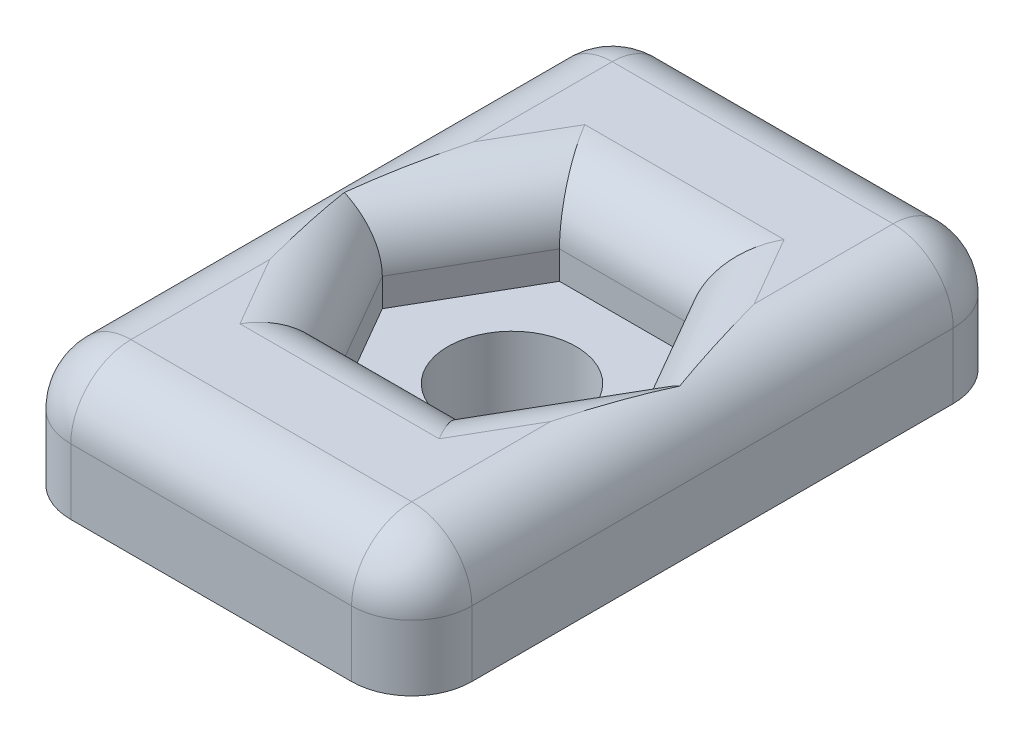
from build123d import *

# Parameters (mm, degrees)
SKETCH1_W            = 10
SKETCH1_H            = 15
BOSS_EXTRUDE1_DEPTH  = 4
CUT_EXTRUDE1_DEPTH   = 2.2
M3_CLEARANCE_HOLE1_D = 3.2
FILLET1_R            = 1.5
CHAMFER1_SIZE        = 0.866025404
CHAMFER1_SIZE_2      = 1.5


with BuildPart() as part:
    # Sketch1 → Boss-Extrude1 (new body)
    with BuildSketch(Plane(origin=(0, 0, 0), x_dir=(1, 0, 0), z_dir=(0, 1, 0))):
        with Locations((5, 7.5)):
            Rectangle(SKETCH1_W, SKETCH1_H)
    extrude(amount=BOSS_EXTRUDE1_DEPTH)

    # Sketch2 → Cut-Extrude1 (cut)
    with BuildSketch(Plane(origin=(0, 4, 0), x_dir=(1, 0, 0), z_dir=(0, 1, 0))):
        Polygon((8.233161507, 7.5), (6.616580754, 10.3), (3.383419246, 10.3), (1.766838493, 7.5), (3.383419246, 4.7), (6.616580754, 4.7), align=None)
    extrude(amount=-CUT_EXTRUDE1_DEPTH, mode=Mode.SUBTRACT)

    # M3 Clearance Hole1 (through all)
    with Locations(Plane(origin=(5, 1.8, -7.5), x_dir=(0, 0, 1), z_dir=(0, 1, 0))):
        with Locations((0, 0)):
            Hole(M3_CLEARANCE_HOLE1_D / 2)

    # Fillet1
    # the kernel refuses this fillet: 1.5 mm, written as the material it takes off along each edge
    with BuildSketch(Plane(origin=(8.5, 2.5, -1.5), x_dir=(1, 0, 0), z_dir=(0, 0, 1))) as fillet1_piece_1_section:
        Polygon((0, 0), (FILLET1_R, 0), (FILLET1_R, FILLET1_R), (0, FILLET1_R), align=None)
    fillet1_piece_1 = extrude(amount=FILLET1_R, mode=Mode.PRIVATE)
    fillet1_piece_1 = fillet1_piece_1 - Plane(origin=(8.5, 2.5, -1.5), x_dir=(-0.7071067811865475, -0.7071067811865475, 0), z_dir=(0, 0, 1)) * Sphere(FILLET1_R, mode=Mode.PRIVATE)
    add(fillet1_piece_1, mode=Mode.SUBTRACT)
    with BuildSketch(Plane(origin=(8.5, 2.5, -13.5), x_dir=(0, 1, 0), z_dir=(1, 0, 0))) as fillet1_piece_2_section:
        Polygon((0, 0), (FILLET1_R, 0), (FILLET1_R, -FILLET1_R), (0, -FILLET1_R), align=None)
    fillet1_piece_2 = extrude(amount=FILLET1_R, mode=Mode.PRIVATE)
    fillet1_piece_2 = fillet1_piece_2 - Plane(origin=(8.5, 2.5, -13.5), x_dir=(0, -0.7071067811865475, 0.7071067811865475), z_dir=(1, 0, 0)) * Sphere(FILLET1_R, mode=Mode.PRIVATE)
    add(fillet1_piece_2, mode=Mode.SUBTRACT)
    with BuildSketch(Plane(origin=(1.5, 2.5, -13.5), x_dir=(0, 1, 0), z_dir=(-1, 0, 0))) as fillet1_piece_3_section:
        Polygon((0, 0), (FILLET1_R, 0), (FILLET1_R, FILLET1_R), (0, FILLET1_R), align=None)
    fillet1_piece_3 = extrude(amount=FILLET1_R, mode=Mode.PRIVATE)
    fillet1_piece_3 = fillet1_piece_3 - Plane(origin=(1.5, 2.5, -13.5), x_dir=(0, -0.7071067811865475, 0.7071067811865475), z_dir=(-1, 0, 0)) * Sphere(FILLET1_R, mode=Mode.PRIVATE)
    add(fillet1_piece_3, mode=Mode.SUBTRACT)
    with BuildSketch(Plane(origin=(1.5, 2.5, -1.5), x_dir=(-1, 0, 0), z_dir=(0, 0, 1))) as fillet1_piece_4_section:
        Polygon((0, 0), (FILLET1_R, 0), (FILLET1_R, -FILLET1_R), (0, -FILLET1_R), align=None)
    fillet1_piece_4 = extrude(amount=FILLET1_R, mode=Mode.PRIVATE)
    fillet1_piece_4 = fillet1_piece_4 - Plane(origin=(1.5, 2.5, -1.5), x_dir=(0.7071067811865475, -0.7071067811865475, 0), z_dir=(0, 0, 1)) * Sphere(FILLET1_R, mode=Mode.PRIVATE)
    add(fillet1_piece_4, mode=Mode.SUBTRACT)
    with BuildSketch(Plane(origin=(10, 4, -1.5), x_dir=(0, -1, 0), z_dir=(0, 0, -1)), Plane(origin=(0, 4, -13.5), x_dir=(0, -1, 0), z_dir=(0, 0, 1))) as fillet1_piece_5:
        with BuildLine():
            CenterArc((FILLET1_R, FILLET1_R), FILLET1_R, 180, 90)
            Line((0, FILLET1_R), (0, 0))
            Line((0, 0), (FILLET1_R, 0))
        make_face()
    extrude(amount=12, mode=Mode.SUBTRACT)
    with BuildSketch(Plane(origin=(8.5, 4, -15), x_dir=(0, 0, 1), z_dir=(-1, 0, 0))) as fillet1_piece_6:
        with BuildLine():
            CenterArc((FILLET1_R, -FILLET1_R), FILLET1_R, 90, 90)
            Line((0, -FILLET1_R), (0, 0))
            Line((0, 0), (FILLET1_R, 0))
        make_face()
    extrude(amount=7, mode=Mode.SUBTRACT)
    with BuildSketch(Plane(origin=(4.741580754, 4, -1.452404736), x_dir=(0.866025403784439, 0, 0.49999999999999933), z_dir=(0.49999999999999933, 0, -0.866025403784439))) as fillet1_piece_7_section:
        with BuildLine():
            CenterArc((FILLET1_R, FILLET1_R), FILLET1_R, 180, 90)
            Line((0, FILLET1_R), (0, 0))
            Line((0, 0), (FILLET1_R, 0))
        make_face()
    fillet1_piece_7 = extrude(amount=10.733161507, mode=Mode.PRIVATE)
    fillet1_piece_7 = split(fillet1_piece_7, bisect_by=Plane(origin=(9.978951884, 4, -4.476202368), z_dir=(-0.8660254037844388, 0, 0.4999999999999998)), keep=Keep.TOP, mode=Mode.PRIVATE)
    fillet1_piece_7 = split(fillet1_piece_7, bisect_by=Plane(origin=(4.741580754, 4, -4.7), z_dir=(0, 0, -1)), keep=Keep.TOP, mode=Mode.PRIVATE)
    add(fillet1_piece_7, mode=Mode.SUBTRACT)
    with BuildSketch(Plane(origin=(10.108161507, 4, -4.252404736), x_dir=(0.8660254037844388, 0, -0.4999999999999998), z_dir=(-0.4999999999999998, 0, -0.8660254037844388))) as fillet1_piece_8_section:
        with BuildLine():
            CenterArc((FILLET1_R, FILLET1_R), FILLET1_R, 180, 90)
            Line((0, FILLET1_R), (0, 0))
            Line((0, 0), (FILLET1_R, 0))
        make_face()
    fillet1_piece_8 = extrude(amount=10.733161507, mode=Mode.PRIVATE)
    fillet1_piece_8 = split(fillet1_piece_8, bisect_by=Plane(origin=(7.295661507, 4, -5.876202368), z_dir=(-0.866025403784439, 0, -0.49999999999999933)), keep=Keep.TOP, mode=Mode.PRIVATE)
    fillet1_piece_8 = split(fillet1_piece_8, bisect_by=Plane(origin=(10.108161507, 4, -10.3), z_dir=(0, 0, 1)), keep=Keep.TOP, mode=Mode.PRIVATE)
    add(fillet1_piece_8, mode=Mode.SUBTRACT)
    with BuildSketch(Plane(origin=(10.366580754, 4, -10.3), x_dir=(0, 0, -1), z_dir=(-1, 0, 0))) as fillet1_piece_9_section:
        with BuildLine():
            CenterArc((FILLET1_R, FILLET1_R), FILLET1_R, 180, 90)
            Line((0, FILLET1_R), (0, 0))
            Line((0, 0), (FILLET1_R, 0))
        make_face()
    fillet1_piece_9 = extrude(amount=10.733161507, mode=Mode.PRIVATE)
    fillet1_piece_9 = split(fillet1_piece_9, bisect_by=Plane(origin=(7.554080754, 4, -8.676202368), z_dir=(-0.8660254037844388, 0, 0.4999999999999998)), keep=Keep.TOP, mode=Mode.PRIVATE)
    fillet1_piece_9 = split(fillet1_piece_9, bisect_by=Plane(origin=(5.129209623, 4, -13.323797632), z_dir=(0.8660254037844387, 0, 0.49999999999999994)), keep=Keep.TOP, mode=Mode.PRIVATE)
    add(fillet1_piece_9, mode=Mode.SUBTRACT)
    with BuildSketch(Plane(origin=(5.258419246, 4, -13.547595264), x_dir=(-0.8660254037844387, 0, -0.49999999999999994), z_dir=(-0.49999999999999994, 0, 0.8660254037844387))) as fillet1_piece_10_section:
        with BuildLine():
            CenterArc((FILLET1_R, FILLET1_R), FILLET1_R, 180, 90)
            Line((0, FILLET1_R), (0, 0))
            Line((0, 0), (FILLET1_R, 0))
        make_face()
    fillet1_piece_10 = extrude(amount=10.733161507, mode=Mode.PRIVATE)
    fillet1_piece_10 = split(fillet1_piece_10, bisect_by=Plane(origin=(5.258419246, 4, -10.3), z_dir=(0, 0, 1)), keep=Keep.TOP, mode=Mode.PRIVATE)
    fillet1_piece_10 = split(fillet1_piece_10, bisect_by=Plane(origin=(0.021048116, 4, -10.523797632), z_dir=(0.8660254037844386, 0, -0.5000000000000001)), keep=Keep.TOP, mode=Mode.PRIVATE)
    add(fillet1_piece_10, mode=Mode.SUBTRACT)
    with BuildSketch(Plane(origin=(-0.108161507, 4, -10.747595264), x_dir=(-0.8660254037844387, 0, 0.5000000000000001), z_dir=(0.5000000000000001, 0, 0.8660254037844386))) as fillet1_piece_11_section:
        with BuildLine():
            CenterArc((FILLET1_R, FILLET1_R), FILLET1_R, 180, 90)
            Line((0, FILLET1_R), (0, 0))
            Line((0, 0), (FILLET1_R, 0))
        make_face()
    fillet1_piece_11 = extrude(amount=10.733161507, mode=Mode.PRIVATE)
    fillet1_piece_11 = split(fillet1_piece_11, bisect_by=Plane(origin=(2.704338493, 4, -9.123797632), z_dir=(0.8660254037844387, 0, 0.49999999999999994)), keep=Keep.TOP, mode=Mode.PRIVATE)
    fillet1_piece_11 = split(fillet1_piece_11, bisect_by=Plane(origin=(-0.108161507, 4, -4.7), z_dir=(0, 0, -1)), keep=Keep.TOP, mode=Mode.PRIVATE)
    add(fillet1_piece_11, mode=Mode.SUBTRACT)
    with BuildSketch(Plane(origin=(-0.366580754, 4, -4.7), x_dir=(0, 0, 1), z_dir=(1, 0, 0))) as fillet1_piece_12_section:
        with BuildLine():
            CenterArc((FILLET1_R, FILLET1_R), FILLET1_R, 180, 90)
            Line((0, FILLET1_R), (0, 0))
            Line((0, 0), (FILLET1_R, 0))
        make_face()
    fillet1_piece_12 = extrude(amount=10.733161507, mode=Mode.PRIVATE)
    fillet1_piece_12 = split(fillet1_piece_12, bisect_by=Plane(origin=(2.445919246, 4, -6.323797632), z_dir=(0.8660254037844386, 0, -0.5000000000000001)), keep=Keep.TOP, mode=Mode.PRIVATE)
    fillet1_piece_12 = split(fillet1_piece_12, bisect_by=Plane(origin=(4.870790377, 4, -1.676202368), z_dir=(-0.866025403784439, 0, -0.49999999999999933)), keep=Keep.TOP, mode=Mode.PRIVATE)
    add(fillet1_piece_12, mode=Mode.SUBTRACT)
    with BuildSketch(Plane(origin=(0, -3.75, -15), x_dir=(0, 0, 1), z_dir=(0, 1, 0)), Plane(origin=(0, -3.75, 0), x_dir=(1, 0, 0), z_dir=(0, 1, 0))) as fillet1_piece_13:
        with BuildLine():
            CenterArc((FILLET1_R, FILLET1_R), FILLET1_R, 180, 90)
            Line((0, FILLET1_R), (0, 0))
            Line((0, 0), (FILLET1_R, 0))
        make_face()
    extrude(amount=6.25, mode=Mode.SUBTRACT)
    with BuildSketch(Plane(origin=(10, -3.75, -15), x_dir=(0, 0, 1), z_dir=(0, 1, 0)), Plane(origin=(10, -3.75, 0), x_dir=(-1, 0, 0), z_dir=(0, 1, 0))) as fillet1_piece_14:
        with BuildLine():
            CenterArc((FILLET1_R, -FILLET1_R), FILLET1_R, 90, 90)
            Line((0, -FILLET1_R), (0, 0))
            Line((0, 0), (FILLET1_R, 0))
        make_face()
    extrude(amount=6.25, mode=Mode.SUBTRACT)
    with BuildSketch(Plane(origin=(1.5, 4, 0), x_dir=(0, -1, 0), z_dir=(1, 0, 0))) as fillet1_piece_15:
        with BuildLine():
            CenterArc((FILLET1_R, FILLET1_R), FILLET1_R, 180, 90)
            Line((0, FILLET1_R), (0, 0))
            Line((0, 0), (FILLET1_R, 0))
        make_face()
    extrude(amount=7, mode=Mode.SUBTRACT)
    with BuildSketch(Plane(origin=(-0.366580754, 4, -4.7), x_dir=(0, 0, 1), z_dir=(1, 0, 0))) as fillet1_piece_16a_section:
        with BuildLine():
            CenterArc((FILLET1_R, FILLET1_R), FILLET1_R, 180, 90)
            Line((0, FILLET1_R), (0, 0))
            Line((0, 0), (FILLET1_R, 0))
        make_face()
    fillet1_piece_16a = extrude(amount=10.733161507, mode=Mode.PRIVATE)
    fillet1_piece_16a = split(fillet1_piece_16a, bisect_by=Plane(origin=(4.870790377, 4, -1.676202368), z_dir=(0.866025403784439, 0, 0.49999999999999933)), keep=Keep.TOP, mode=Mode.PRIVATE)
    with BuildSketch(Plane(origin=(4.741580754, 4, -1.452404736), x_dir=(0.866025403784439, 0, 0.49999999999999933), z_dir=(0.49999999999999933, 0, -0.866025403784439))) as fillet1_piece_16b_section:
        with BuildLine():
            CenterArc((FILLET1_R, FILLET1_R), FILLET1_R, 180, 90)
            Line((0, FILLET1_R), (0, 0))
            Line((0, 0), (FILLET1_R, 0))
        make_face()
    fillet1_piece_16b = extrude(amount=10.733161507, mode=Mode.PRIVATE)
    fillet1_piece_16b = split(fillet1_piece_16b, bisect_by=Plane(origin=(4.741580754, 4, -4.7), z_dir=(0, 0, 1)), keep=Keep.TOP, mode=Mode.PRIVATE)
    fillet1_piece_16 = fillet1_piece_16a & fillet1_piece_16b
    add(fillet1_piece_16, mode=Mode.SUBTRACT)
    with BuildSketch(Plane(origin=(10.108161507, 4, -4.252404736), x_dir=(0.8660254037844388, 0, -0.4999999999999998), z_dir=(-0.4999999999999998, 0, -0.8660254037844388))) as fillet1_piece_17a_section:
        with BuildLine():
            CenterArc((FILLET1_R, FILLET1_R), FILLET1_R, 180, 90)
            Line((0, FILLET1_R), (0, 0))
            Line((0, 0), (FILLET1_R, 0))
        make_face()
    fillet1_piece_17a = extrude(amount=10.733161507, mode=Mode.PRIVATE)
    fillet1_piece_17a = split(fillet1_piece_17a, bisect_by=Plane(origin=(7.295661507, 4, -5.876202368), z_dir=(0.866025403784439, 0, 0.49999999999999933)), keep=Keep.TOP, mode=Mode.PRIVATE)
    with BuildSketch(Plane(origin=(4.741580754, 4, -1.452404736), x_dir=(0.866025403784439, 0, 0.49999999999999933), z_dir=(0.49999999999999933, 0, -0.866025403784439))) as fillet1_piece_17b_section:
        with BuildLine():
            CenterArc((FILLET1_R, FILLET1_R), FILLET1_R, 180, 90)
            Line((0, FILLET1_R), (0, 0))
            Line((0, 0), (FILLET1_R, 0))
        make_face()
    fillet1_piece_17b = extrude(amount=10.733161507, mode=Mode.PRIVATE)
    fillet1_piece_17b = split(fillet1_piece_17b, bisect_by=Plane(origin=(9.978951884, 4, -4.476202368), z_dir=(0.8660254037844388, 0, -0.4999999999999998)), keep=Keep.TOP, mode=Mode.PRIVATE)
    fillet1_piece_17 = fillet1_piece_17a & fillet1_piece_17b
    add(fillet1_piece_17, mode=Mode.SUBTRACT)
    with BuildSketch(Plane(origin=(10.108161507, 4, -4.252404736), x_dir=(0.8660254037844388, 0, -0.4999999999999998), z_dir=(-0.4999999999999998, 0, -0.8660254037844388))) as fillet1_piece_18a_section:
        with BuildLine():
            CenterArc((FILLET1_R, FILLET1_R), FILLET1_R, 180, 90)
            Line((0, FILLET1_R), (0, 0))
            Line((0, 0), (FILLET1_R, 0))
        make_face()
    fillet1_piece_18a = extrude(amount=10.733161507, mode=Mode.PRIVATE)
    fillet1_piece_18a = split(fillet1_piece_18a, bisect_by=Plane(origin=(10.108161507, 4, -10.3), z_dir=(0, 0, -1)), keep=Keep.TOP, mode=Mode.PRIVATE)
    with BuildSketch(Plane(origin=(10.366580754, 4, -10.3), x_dir=(0, 0, -1), z_dir=(-1, 0, 0))) as fillet1_piece_18b_section:
        with BuildLine():
            CenterArc((FILLET1_R, FILLET1_R), FILLET1_R, 180, 90)
            Line((0, FILLET1_R), (0, 0))
            Line((0, 0), (FILLET1_R, 0))
        make_face()
    fillet1_piece_18b = extrude(amount=10.733161507, mode=Mode.PRIVATE)
    fillet1_piece_18b = split(fillet1_piece_18b, bisect_by=Plane(origin=(7.554080754, 4, -8.676202368), z_dir=(0.8660254037844388, 0, -0.4999999999999998)), keep=Keep.TOP, mode=Mode.PRIVATE)
    fillet1_piece_18 = fillet1_piece_18a & fillet1_piece_18b
    add(fillet1_piece_18, mode=Mode.SUBTRACT)
    with BuildSketch(Plane(origin=(10.366580754, 4, -10.3), x_dir=(0, 0, -1), z_dir=(-1, 0, 0))) as fillet1_piece_19a_section:
        with BuildLine():
            CenterArc((FILLET1_R, FILLET1_R), FILLET1_R, 180, 90)
            Line((0, FILLET1_R), (0, 0))
            Line((0, 0), (FILLET1_R, 0))
        make_face()
    fillet1_piece_19a = extrude(amount=10.733161507, mode=Mode.PRIVATE)
    fillet1_piece_19a = split(fillet1_piece_19a, bisect_by=Plane(origin=(5.129209623, 4, -13.323797632), z_dir=(-0.8660254037844387, 0, -0.49999999999999994)), keep=Keep.TOP, mode=Mode.PRIVATE)
    with BuildSketch(Plane(origin=(5.258419246, 4, -13.547595264), x_dir=(-0.8660254037844387, 0, -0.49999999999999994), z_dir=(-0.49999999999999994, 0, 0.8660254037844387))) as fillet1_piece_19b_section:
        with BuildLine():
            CenterArc((FILLET1_R, FILLET1_R), FILLET1_R, 180, 90)
            Line((0, FILLET1_R), (0, 0))
            Line((0, 0), (FILLET1_R, 0))
        make_face()
    fillet1_piece_19b = extrude(amount=10.733161507, mode=Mode.PRIVATE)
    fillet1_piece_19b = split(fillet1_piece_19b, bisect_by=Plane(origin=(5.258419246, 4, -10.3), z_dir=(0, 0, -1)), keep=Keep.TOP, mode=Mode.PRIVATE)
    fillet1_piece_19 = fillet1_piece_19a & fillet1_piece_19b
    add(fillet1_piece_19, mode=Mode.SUBTRACT)
    with BuildSketch(Plane(origin=(5.258419246, 4, -13.547595264), x_dir=(-0.8660254037844387, 0, -0.49999999999999994), z_dir=(-0.49999999999999994, 0, 0.8660254037844387))) as fillet1_piece_20a_section:
        with BuildLine():
            CenterArc((FILLET1_R, FILLET1_R), FILLET1_R, 180, 90)
            Line((0, FILLET1_R), (0, 0))
            Line((0, 0), (FILLET1_R, 0))
        make_face()
    fillet1_piece_20a = extrude(amount=10.733161507, mode=Mode.PRIVATE)
    fillet1_piece_20a = split(fillet1_piece_20a, bisect_by=Plane(origin=(0.021048116, 4, -10.523797632), z_dir=(-0.8660254037844386, 0, 0.5000000000000001)), keep=Keep.TOP, mode=Mode.PRIVATE)
    with BuildSketch(Plane(origin=(-0.108161507, 4, -10.747595264), x_dir=(-0.8660254037844387, 0, 0.5000000000000001), z_dir=(0.5000000000000001, 0, 0.8660254037844386))) as fillet1_piece_20b_section:
        with BuildLine():
            CenterArc((FILLET1_R, FILLET1_R), FILLET1_R, 180, 90)
            Line((0, FILLET1_R), (0, 0))
            Line((0, 0), (FILLET1_R, 0))
        make_face()
    fillet1_piece_20b = extrude(amount=10.733161507, mode=Mode.PRIVATE)
    fillet1_piece_20b = split(fillet1_piece_20b, bisect_by=Plane(origin=(2.704338493, 4, -9.123797632), z_dir=(-0.8660254037844387, 0, -0.49999999999999994)), keep=Keep.TOP, mode=Mode.PRIVATE)
    fillet1_piece_20 = fillet1_piece_20a & fillet1_piece_20b
    add(fillet1_piece_20, mode=Mode.SUBTRACT)
    with BuildSketch(Plane(origin=(-0.108161507, 4, -10.747595264), x_dir=(-0.8660254037844387, 0, 0.5000000000000001), z_dir=(0.5000000000000001, 0, 0.8660254037844386))) as fillet1_piece_21a_section:
        with BuildLine():
            CenterArc((FILLET1_R, FILLET1_R), FILLET1_R, 180, 90)
            Line((0, FILLET1_R), (0, 0))
            Line((0, 0), (FILLET1_R, 0))
        make_face()
    fillet1_piece_21a = extrude(amount=10.733161507, mode=Mode.PRIVATE)
    fillet1_piece_21a = split(fillet1_piece_21a, bisect_by=Plane(origin=(-0.108161507, 4, -4.7), z_dir=(0, 0, 1)), keep=Keep.TOP, mode=Mode.PRIVATE)
    with BuildSketch(Plane(origin=(-0.366580754, 4, -4.7), x_dir=(0, 0, 1), z_dir=(1, 0, 0))) as fillet1_piece_21b_section:
        with BuildLine():
            CenterArc((FILLET1_R, FILLET1_R), FILLET1_R, 180, 90)
            Line((0, FILLET1_R), (0, 0))
            Line((0, 0), (FILLET1_R, 0))
        make_face()
    fillet1_piece_21b = extrude(amount=10.733161507, mode=Mode.PRIVATE)
    fillet1_piece_21b = split(fillet1_piece_21b, bisect_by=Plane(origin=(2.445919246, 4, -6.323797632), z_dir=(-0.8660254037844386, 0, 0.5000000000000001)), keep=Keep.TOP, mode=Mode.PRIVATE)
    fillet1_piece_21 = fillet1_piece_21a & fillet1_piece_21b
    add(fillet1_piece_21, mode=Mode.SUBTRACT)

    # Chamfer1
    # the kernel refuses this chamfer: 1.5, 0.866025404 mm, written as the material it takes off along each edge
    with BuildSketch(Plane(origin=(8.5, 0, -15), x_dir=(0, 1, 0), z_dir=(-1, 0, 0)), Plane(origin=(1.5, 0, 0), x_dir=(0, 1, 0), z_dir=(1, 0, 0))) as chamfer1_piece_1:
        Polygon((CHAMFER1_SIZE, 0), (0, -CHAMFER1_SIZE_2), (0, 0), align=None)
    extrude(amount=7, mode=Mode.SUBTRACT)
    with BuildSketch(Plane(origin=(10, 0, -1.5), x_dir=(0, 1, 0), z_dir=(0, 0, -1)), Plane(origin=(0, 0, -13.5), x_dir=(0, 1, 0), z_dir=(0, 0, 1))) as chamfer1_piece_2:
        Polygon((CHAMFER1_SIZE, 0), (0, -CHAMFER1_SIZE_2), (0, 0), align=None)
    extrude(amount=12, mode=Mode.SUBTRACT)
    with BuildSketch(Plane(origin=(8.5, 0, -13.5), x_dir=(0, 0, -1), z_dir=(-1, 0, 0))) as chamfer1_piece_3:
        Polygon((1.5, -CHAMFER1_SIZE), (1.5 - CHAMFER1_SIZE_2, 0), (1.5, 0), align=None)
    revolve(axis=Axis((8.5, 0, -13.5), (0, -1, 0)), revolution_arc=90, mode=Mode.SUBTRACT)
    with BuildSketch(Plane(origin=(1.5, 0, -13.5), x_dir=(-1, 0, 0), z_dir=(0, 0, 1))) as chamfer1_piece_4:
        Polygon((1.5, -CHAMFER1_SIZE), (1.5 - CHAMFER1_SIZE_2, 0), (1.5, 0), align=None)
    revolve(axis=Axis((1.5, 0, -13.5), (0, -1, 0)), revolution_arc=90, mode=Mode.SUBTRACT)
    with BuildSketch(Plane(origin=(1.5, 0, -1.5), x_dir=(0, 0, 1), z_dir=(1, 0, 0))) as chamfer1_piece_5:
        Polygon((1.5, -CHAMFER1_SIZE), (1.5 - CHAMFER1_SIZE_2, 0), (1.5, 0), align=None)
    revolve(axis=Axis((1.5, 0, -1.5), (0, -1, 0)), revolution_arc=90, mode=Mode.SUBTRACT)
    with BuildSketch(Plane(origin=(8.5, 0, -1.5), x_dir=(1, 0, 0), z_dir=(0, 0, -1))) as chamfer1_piece_6:
        Polygon((1.5, -CHAMFER1_SIZE), (1.5 - CHAMFER1_SIZE_2, 0), (1.5, 0), align=None)
    revolve(axis=Axis((8.5, 0, -1.5), (0, -1, 0)), revolution_arc=90, mode=Mode.SUBTRACT)


solid = part.part
